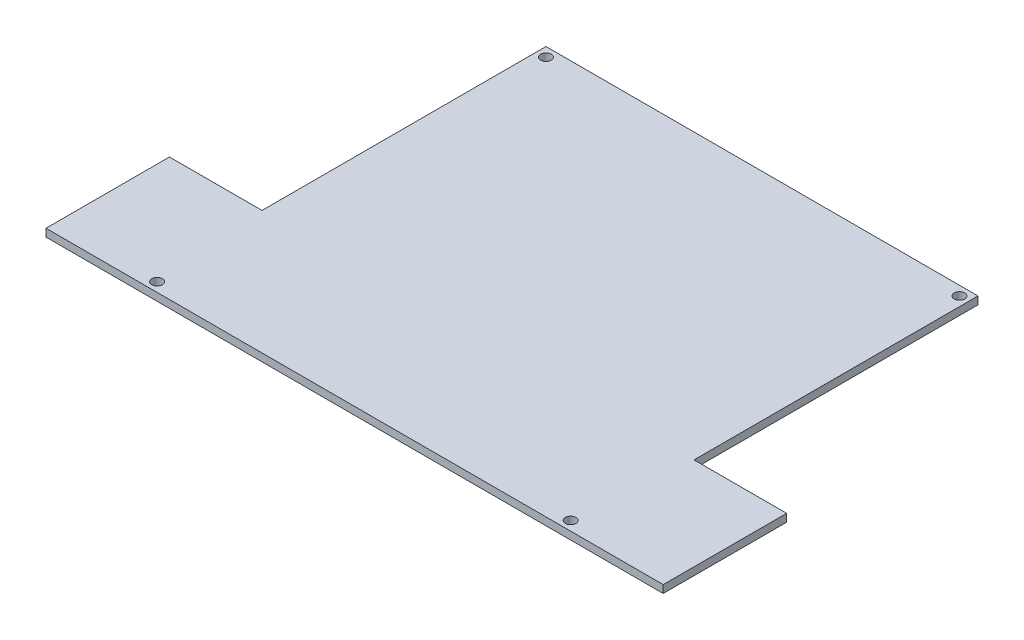
from build123d import *

# Parameters (mm, degrees)
BOSS_EXTRUDE1_DEPTH = 3.175
SKETCH2_R           = 2.1717
CUT_EXTRUDE1_DEPTH  = 3.175


with BuildPart() as part:
    # Sketch1 → Boss-Extrude1 (new body)
    with BuildSketch(Plane(origin=(0, 0, 0), x_dir=(1, 0, 0), z_dir=(0, 1, 0))):
        Polygon((-52.922181171, 15.760280827), (124.877818829, 15.760280827), (124.877818829, -101.079719173), (162.977818829, -101.079719173), (162.977818829, -151.879719173), (124.877818829, -151.879719173), (-52.922181171, -151.879719173), (-91.022181171, -151.879719173), (-91.022181171, -101.079719173), (-52.922181171, -101.079719173), align=None)
    extrude(amount=BOSS_EXTRUDE1_DEPTH)

    # Sketch2 → Cut-Extrude1 (cut)
    with BuildSketch(Plane(origin=(0, 3.175, 0), x_dir=(1, 0, 0), z_dir=(0, 1, 0))):
        with Locations((-49.112181171, 11.950280827)):
            Circle(SKETCH2_R)
        with Locations((121.067818829, 11.950280827)):
            Circle(SKETCH2_R)
        with Locations((-49.112181171, -148.069719173)):
            Circle(SKETCH2_R)
        with Locations((121.067818829, -148.069719173)):
            Circle(SKETCH2_R)
    extrude(amount=-CUT_EXTRUDE1_DEPTH, mode=Mode.SUBTRACT)


solid = part.part
